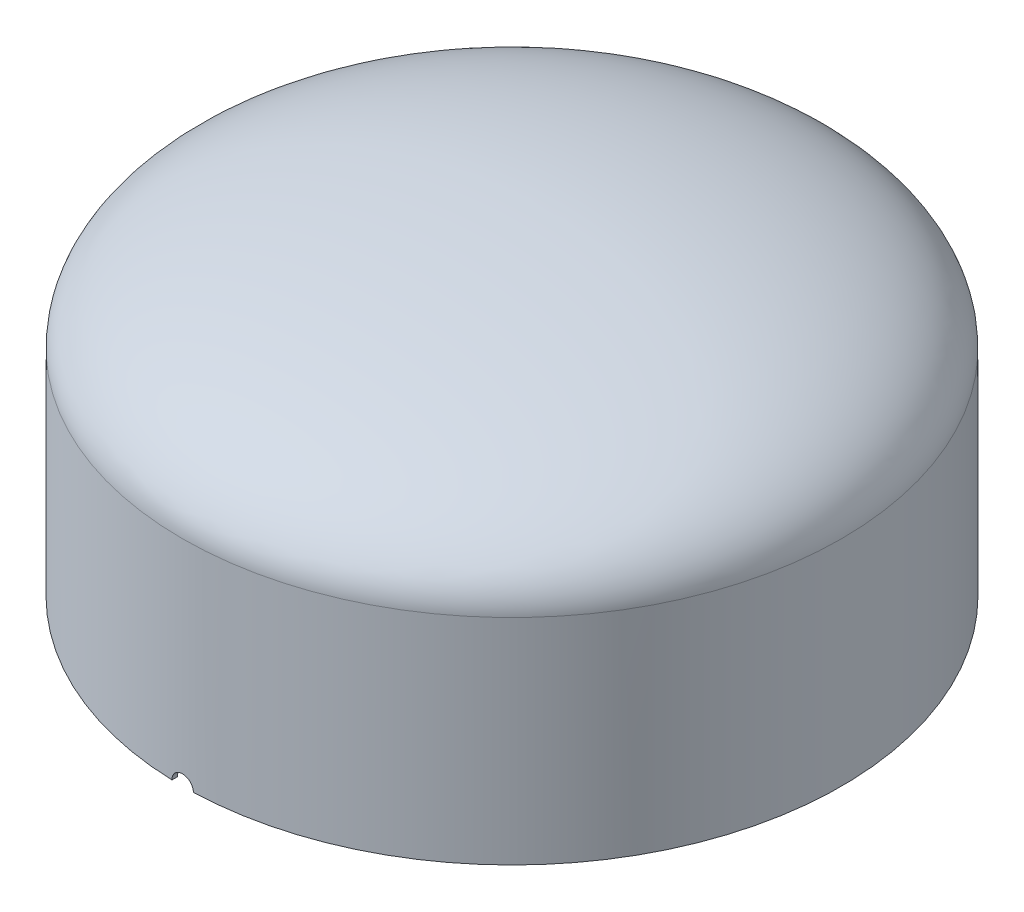
from build123d import *

# Parameters (mm, degrees)
CUT_EXTRUDE1_DEPTH      = 165.862
CUT_EXTRUDE1_DEPTH_BACK = 157.734
SKETCH2_R               = 5.08


with BuildPart() as part:
    # Sketch1 → Revolve1 (revolve)
    with BuildSketch(Plane.XY):
        with BuildLine():
            Line((0, 52.55630226), (0, 55.09630226))
            add(Edge.make_bspline(
                [(156.21, 0), (156.21, 1.962448823), (155.642545793, 5.887346468), (152.334003038, 13.472944531), (144.475116829, 22.260087764), (129.732384417, 31.670498958), (110.170801746, 39.816376352), (86.482741979, 46.461472516), (50.559420338, 53.030903611), (20.223768135, 55.09630226), (0, 55.09630226)],
                knots=[3.141592654, 3.141592654, 3.141592654, 3.141592654, 3.239767424, 3.337942194, 3.534291735, 3.730641276, 3.926990817, 4.123340358, 4.319689899, 4.71238898, 4.71238898, 4.71238898, 4.71238898], degree=3))
            Line((156.21, 0), (156.21, -101.6))
            Line((156.21, -101.6), (153.67, -101.6))
            Line((153.67, -101.6), (153.67, 0))
            add(Edge.make_bspline(
                [(153.67, 0), (153.67, 52.55630226), (0, 52.55630226)],
                knots=[3.141592654, 3.141592654, 3.141592654, 4.71238898, 4.71238898, 4.71238898], degree=2, weights=[1, 0.707106781, 1]))
        make_face()
    revolve(axis=Axis((0, 0, 0), (0, 1, 0)))

    # Sketch2 → Cut-Extrude1 (cut, two sides: drawn at the far end of the back side and taken through both)
    with BuildSketch(Plane.XY.offset(-CUT_EXTRUDE1_DEPTH_BACK)):
        with Locations((0, -101.6)):
            Circle(SKETCH2_R)
    extrude(amount=CUT_EXTRUDE1_DEPTH + CUT_EXTRUDE1_DEPTH_BACK, mode=Mode.SUBTRACT)


solid = part.part
